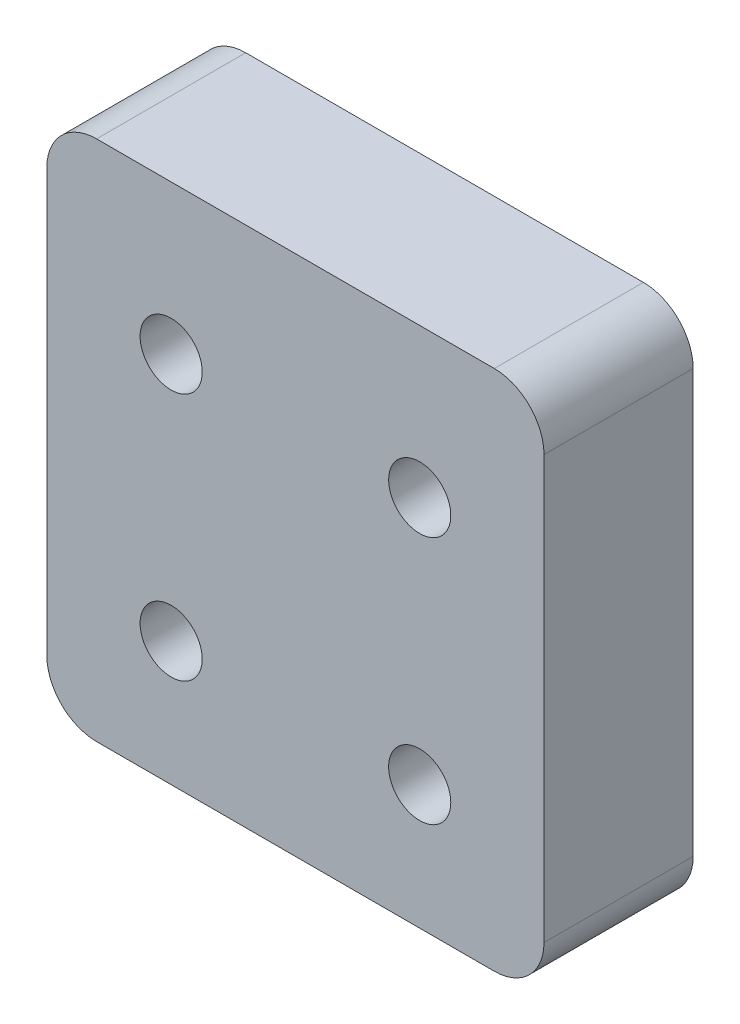
from build123d import *

# Parameters (mm, degrees)
ESQUISSE1_W             = 40
ESQUISSE1_H             = 42
BOSS_EXTRU_1_DEPTH      = 12
ESQUISSE2_R             = 2.5
ENL_V_MAT_EXTRU_1_DEPTH = 60.22837158
CONG_1_R                = 4


with BuildPart() as part:
    # Esquisse1 → Boss.-Extru.1 (new body)
    with BuildSketch(Plane.XY):
        with Locations((20, 21)):
            Rectangle(ESQUISSE1_W, ESQUISSE1_H)
    extrude(amount=BOSS_EXTRU_1_DEPTH)

    # Esquisse2 → Enlèv. mat.-Extru.1 (cut, through all)
    with BuildSketch(Plane.XY.offset(12)):
        with Locations((10, 30)):
            Circle(ESQUISSE2_R)
        with Locations((10, 10)):
            Circle(ESQUISSE2_R)
        with Locations((30, 10)):
            Circle(ESQUISSE2_R)
        with Locations((30, 30)):
            Circle(ESQUISSE2_R)
    extrude(amount=-ENL_V_MAT_EXTRU_1_DEPTH, mode=Mode.SUBTRACT)

    # Congé1
    cong_1_edges = [part.edges().sort_by_distance(p)[0] for p in [
        (40, 42, 6),
        (40, 0, 6),
        (0, 0, 6),
        (0, 42, 6),
    ]]
    fillet(cong_1_edges, radius=CONG_1_R)


solid = part.part
